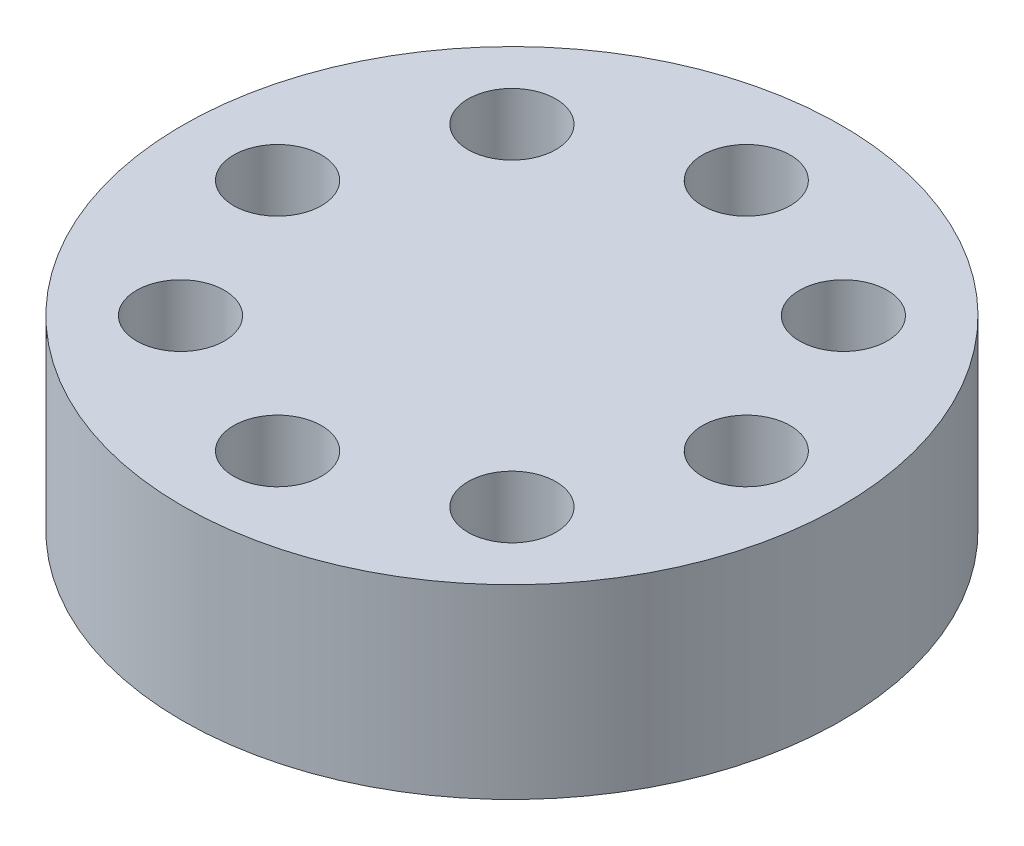
from build123d import *

# Parameters (mm, degrees)
SKETCH1_R           = 22.5
BOSS_EXTRUDE1_DEPTH = 12.7
SKETCH2_R           = 3
CUT_EXTRUDE1_DEPTH  = 35.260618792


with BuildPart() as part:
    # Sketch1 → Boss-Extrude1 (new body)
    with BuildSketch(Plane(origin=(0, 0, 0), x_dir=(1, 0, 0), z_dir=(0, 1, 0))):
        Circle(SKETCH1_R)
    extrude(amount=BOSS_EXTRUDE1_DEPTH)

    # Sketch2 → Cut-Extrude1 (cut, through all)
    with BuildSketch(Plane(origin=(0, 12.7, 0), x_dir=(1, 0, 0), z_dir=(0, 1, 0))):
        with Locations((-16, 0)):
            Circle(SKETCH2_R)
        with Locations((-11.313708499, 11.313708499)):
            Circle(SKETCH2_R)
        with Locations((0, 16)):
            Circle(SKETCH2_R)
        with Locations((11.313708499, 11.313708499)):
            Circle(SKETCH2_R)
        with Locations((16, 0)):
            Circle(SKETCH2_R)
        with Locations((11.313708499, -11.313708499)):
            Circle(SKETCH2_R)
        with Locations((0, -16)):
            Circle(SKETCH2_R)
        with Locations((-11.313708499, -11.313708499)):
            Circle(SKETCH2_R)
    extrude(amount=-CUT_EXTRUDE1_DEPTH, mode=Mode.SUBTRACT)


solid = part.part
